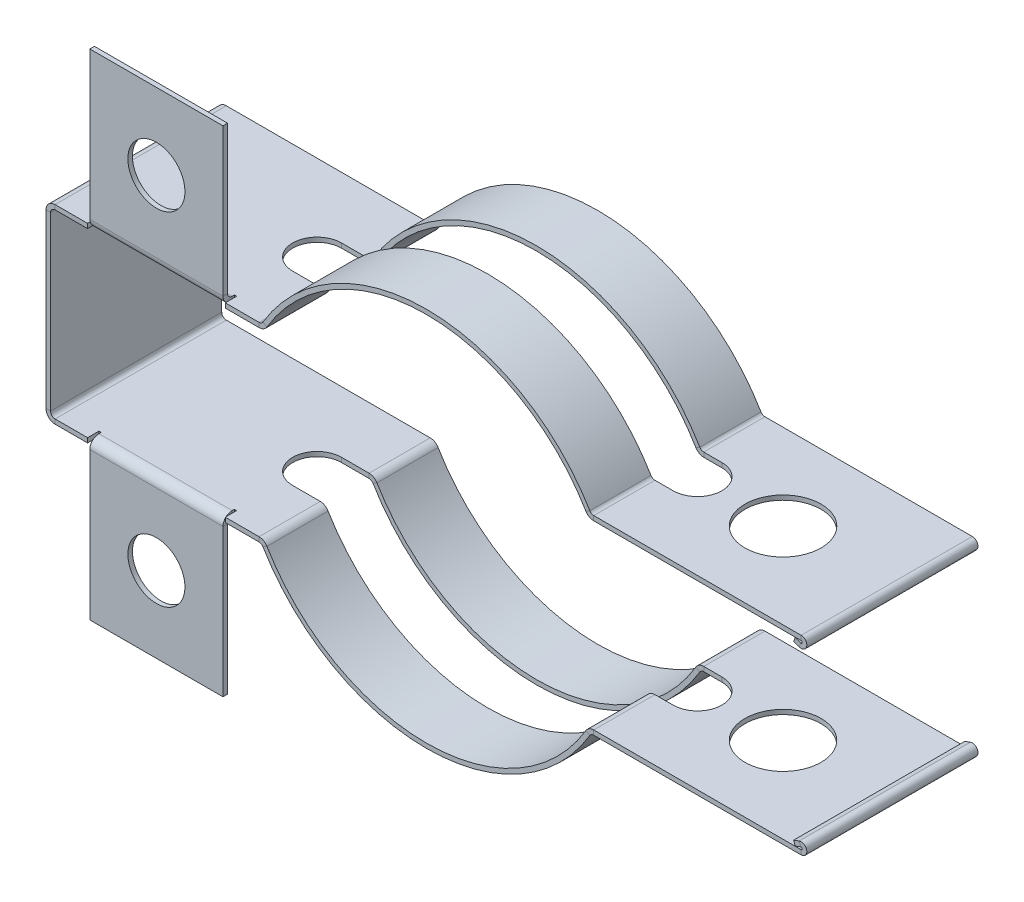
from build123d import *

# Parameters (mm, degrees)
BASE_FLANGE1_START            = -28.575
BASE_FLANGE1_DEPTH            = 57.15
EDGE_FLANGE2_STRIP_W          = 9.144
EDGE_FLANGE2_STRIP_H          = 1.524
EDGE_FLANGE2_STRIP_CUT_DEPTH  = 44.45
EDGE_FLANGE2_RELIEF_W         = 9.906
EDGE_FLANGE2_RELIEF_H         = 0.762
EDGE_FLANGE2_RELIEF_CUT_DEPTH = 1.524
EDGE_FLANGE2_DEPTH            = 44.45
EDGE_FLANGE2_PROFILE_W        = 44.45
EDGE_FLANGE2_PROFILE_H        = 49.276
EDGE_FLANGE2_PROFILE_R        = 9.525
EDGE_FLANGE2_FLAT_DEPTH       = 1.524
HEM1_START                    = -28.575
HEM1_DEPTH                    = 57.15
HEM1_2_DEPTH                  = 57.15
SKETCH22_R                    = 12.7
CUT_EXTRUDE1_DEPTH            = 174.234005394
CUT_EXTRUDE2_DEPTH            = 174.234005394
CUT_EXTRUDE2_DEPTH_BACK       = 174.234005394


with BuildPart() as part:
    # Base-Flange1: read off the stored shape, not the designer's step
    # Base-Flange1 outline → Base-Flange1 (new body)
    with BuildSketch(Plane.XY.offset(BASE_FLANGE1_START)):
        with BuildLine():
            Line((55.865566318, 30.226), (127, 30.226))
            Line((127, 30.226), (127, 31.75))
            Line((127, 31.75), (55.865566318, 31.75))
            ThreePointArc((55.865566318, 31.75), (55.11254895, 31.949031757), (54.556217107, 32.494140625))
            ThreePointArc((54.556217107, 32.494140625), (0, 63.5), (-54.556217107, 32.494140625))
            ThreePointArc((-54.556217107, 32.494140625), (-55.11254895, 31.949031757), (-55.865566318, 31.75))
            Line((-55.865566318, 31.75), (-123.952, 31.75))
            ThreePointArc((-123.952, 31.75), (-126.107261469, 30.857261469), (-127, 28.702))
            Line((-127, 28.702), (-127, -28.702))
            ThreePointArc((-127, -28.702), (-126.107261469, -30.857261469), (-123.952, -31.75))
            Line((-123.952, -31.75), (-55.865566318, -31.75))
            ThreePointArc((-55.865566318, -31.75), (-55.11254895, -31.949031757), (-54.556217107, -32.494140625))
            ThreePointArc((-54.556217107, -32.494140625), (0, -63.5), (54.556217107, -32.494140625))
            ThreePointArc((54.556217107, -32.494140625), (55.11254895, -31.949031757), (55.865566318, -31.75))
            Line((55.865566318, -31.75), (127, -31.75))
            Line((127, -31.75), (127, -30.226))
            Line((127, -30.226), (55.865566318, -30.226))
            ThreePointArc((55.865566318, -30.226), (54.359531582, -30.624063515), (53.246867897, -31.71428125))
            ThreePointArc((53.246867897, -31.71428125), (0, -61.976), (-53.246867897, -31.71428125))
            ThreePointArc((-53.246867897, -31.71428125), (-54.359531582, -30.624063515), (-55.865566318, -30.226))
            Line((-55.865566318, -30.226), (-123.952, -30.226))
            ThreePointArc((-123.952, -30.226), (-125.029630735, -29.779630735), (-125.476, -28.702))
            Line((-125.476, -28.702), (-125.476, 28.702))
            ThreePointArc((-125.476, 28.702), (-125.029630735, 29.779630735), (-123.952, 30.226))
            Line((-123.952, 30.226), (-55.865566318, 30.226))
            ThreePointArc((-55.865566318, 30.226), (-54.359531582, 30.624063515), (-53.246867897, 31.71428125))
            ThreePointArc((-53.246867897, 31.71428125), (0, 61.976), (53.246867897, 31.71428125))
            ThreePointArc((53.246867897, 31.71428125), (54.359531582, 30.624063515), (55.865566318, 30.226))
        make_face()
    extrude(amount=BASE_FLANGE1_DEPTH)

    # Edge-Flange2: sheet metal written as solids
    # Edge-Flange2 strip (on a plane across the edge) → Edge-Flange2 strip cut (cut)
    with BuildSketch(Plane(origin=(-112.365340231, 31.75, 28.575), x_dir=(0, 0, -1), z_dir=(1, 0, 0))):
        with Locations((-1.524, -0.762)):
            Rectangle(EDGE_FLANGE2_STRIP_W, EDGE_FLANGE2_STRIP_H)
    edge_flange2_strip_cut = extrude(amount=EDGE_FLANGE2_STRIP_CUT_DEPTH, mode=Mode.SUBTRACT)

    # Edge-Flange2 relief (on the sheet) → Edge-Flange2 relief cut (cut)
    with BuildSketch(Plane(origin=(-112.365340231, 31.75, 25.527), x_dir=(0, 0, -1), z_dir=(0, 1, 0))):
        with Locations((-4.191, 0.381)):
            Rectangle(EDGE_FLANGE2_RELIEF_W, EDGE_FLANGE2_RELIEF_H)
        with Locations((-4.191, -44.831)):
            Rectangle(EDGE_FLANGE2_RELIEF_W, EDGE_FLANGE2_RELIEF_H)
    edge_flange2_relief_cut = extrude(amount=-EDGE_FLANGE2_RELIEF_CUT_DEPTH, mode=Mode.SUBTRACT)

    # Edge-Flange2 bend section (on a plane across the edge) → Edge-Flange2 (add)
    with BuildSketch(Plane(origin=(-112.365340231, 31.75, 28.575), x_dir=(0, 0, -1), z_dir=(1, 0, 0))):
        with BuildLine():
            Line((0, 1.524), (1.524, 1.524))
            ThreePointArc((1.524, 1.524), (1.970369265, 0.446369265), (3.048, 0))
            Line((3.048, 0), (3.048, -1.524))
            ThreePointArc((3.048, -1.524), (0.892738531, -0.631261469), (0, 1.524))
        make_face()
    edge_flange2 = extrude(amount=EDGE_FLANGE2_DEPTH)

    # Edge-Flange2 profile (on flange) → Edge-Flange2 flat (add)
    with BuildSketch(Plane(origin=(0, 31.75, 28.575), x_dir=(1, 0, 0), z_dir=(0, 0, 1))):
        with Locations((-90.140340231, 26.162)):
            Rectangle(EDGE_FLANGE2_PROFILE_W, EDGE_FLANGE2_PROFILE_H)
        with Locations((-90.140340231, 25.4)):
            Circle(EDGE_FLANGE2_PROFILE_R, mode=Mode.SUBTRACT)
    edge_flange2_flat = extrude(amount=-EDGE_FLANGE2_FLAT_DEPTH)

    # Mirror1: Edge-Flange2 strip cut, Edge-Flange2 relief cut, Edge-Flange2, Edge-Flange2 flat across plane
    add(edge_flange2_strip_cut.mirror(Plane.ZX), mode=Mode.SUBTRACT)
    add(edge_flange2_relief_cut.mirror(Plane.ZX), mode=Mode.SUBTRACT)
    add(edge_flange2.mirror(Plane.ZX))
    add(edge_flange2_flat.mirror(Plane.ZX))

    # Hem1: read off the stored shape, not the designer's step
    # Hem1 outline → Hem1 (cut)
    with BuildSketch(Plane.XY.offset(HEM1_START)):
        with BuildLine():
            ThreePointArc((125.095, 31.75), (126.299827788, 31.320606655), (126.961511183, 30.226))
            Line((126.961511183, 30.226), (127, 30.226))
            Line((127, 30.226), (127, 31.75))
            Line((127, 31.75), (125.095, 31.75))
        make_face()
        with BuildLine():
            Line((127, -30.226), (126.961511183, -30.226))
            ThreePointArc((126.961511183, -30.226), (126.299827788, -31.320606655), (125.095, -31.75))
            Line((125.095, -31.75), (127, -31.75))
            Line((127, -31.75), (127, -30.226))
        make_face()
    extrude(amount=HEM1_DEPTH, mode=Mode.SUBTRACT)

    # Hem1 2 outline → Hem1 2 (add)
    with BuildSketch(Plane.XY.offset(HEM1_START)):
        with BuildLine():
            Line((123.122180151, 30.157595971), (122.600941452, 28.725504417))
            Line((122.600941452, 28.725504417), (124.443451627, 28.054885557))
            ThreePointArc((124.443451627, 28.054885557), (126.338972724, 28.402239846), (126.961511183, 30.226))
            Line((126.961511183, 30.226), (125.095, 30.226))
            ThreePointArc((125.095, 30.226), (125.470211754, 29.778840044), (124.964690325, 29.486977111))
            Line((124.964690325, 29.486977111), (123.122180151, 30.157595971))
        make_face()
        with BuildLine():
            Line((122.600941452, -28.725504417), (123.122180151, -30.157595971))
            Line((123.122180151, -30.157595971), (124.964690325, -29.486977111))
            ThreePointArc((124.964690325, -29.486977111), (125.470211754, -29.778840044), (125.095, -30.226))
            Line((125.095, -30.226), (126.961511183, -30.226))
            ThreePointArc((126.961511183, -30.226), (126.338972724, -28.402239846), (124.443451627, -28.054885557))
            Line((124.443451627, -28.054885557), (122.600941452, -28.725504417))
        make_face()
    extrude(amount=HEM1_2_DEPTH)

    # Sketch22 → Cut-Extrude1 (cut, through all)
    with BuildSketch(Plane(origin=(0, 31.75, 0), x_dir=(1, 0, 0), z_dir=(0, 1, 0))):
        with Locations(Location((90.480283159, 0, 0), (0, 0, 90))):
            Circle(SKETCH22_R)
    extrude(amount=-CUT_EXTRUDE1_DEPTH, mode=Mode.SUBTRACT)

    # Sketch23 → Cut-Extrude2 (cut, two sides: drawn at the far end of the back side and taken through both)
    with BuildSketch(Plane(origin=(0, 31.75, 0), x_dir=(1, 0, 0), z_dir=(0, 1, 0)).offset(-CUT_EXTRUDE2_DEPTH_BACK)):
        with BuildLine():
            Line((-65.067682155, 8.15016142), (61.932317845, 8.15016142))
            ThreePointArc((61.932317845, 8.15016142), (70.082479265, 0), (61.932317845, -8.15016142))
            Line((61.932317845, -8.15016142), (-65.067682155, -8.15016142))
            ThreePointArc((-65.067682155, -8.15016142), (-73.217843575, 0), (-65.067682155, 8.15016142))
        make_face()
    extrude(amount=CUT_EXTRUDE2_DEPTH + CUT_EXTRUDE2_DEPTH_BACK, mode=Mode.SUBTRACT)


solid = part.part
